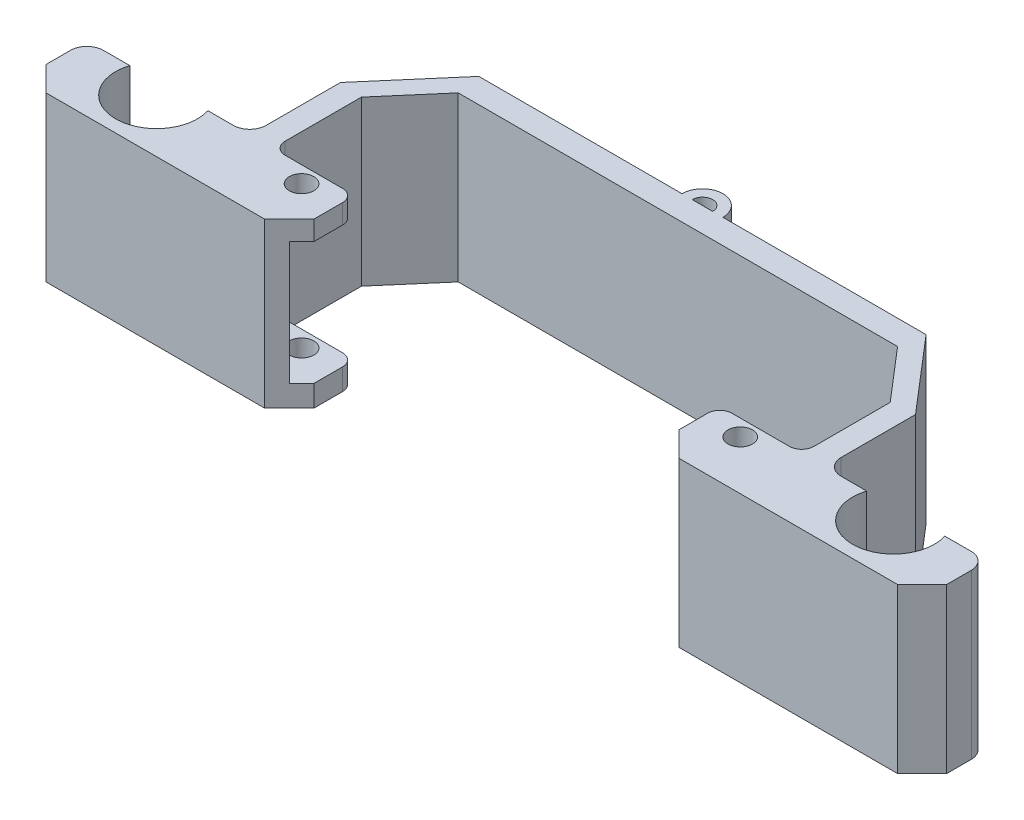
from build123d import *

# Parameters (mm, degrees)
EXTRUDE_1_DEPTH     = 20
SKETCH_2_W          = 10
SKETCH_2_H          = 8
SKETCH_2_R          = 1.5
EXTRUDE_2_DEPTH     = 20
SKETCH_3_W          = 10
SKETCH_3_H          = 15
CUT_EXTRUDE_1_DEPTH = 6.5
CHAMFER_1_SIZE      = 3
FILLET_1_R          = 2
FILLET_2_R          = 1.5
EXTRUDE_3_DEPTH     = 20


with BuildPart() as part:
    # 草图1 → 凸台-拉伸1 (new body)
    with BuildSketch(Plane(origin=(0, 0, 0), x_dir=(1, 0, 0), z_dir=(0, 1, 0))):
        with BuildLine():
            Line((-52.384848004, 0), (-49.769696007, 0))
            ThreePointArc((-49.769696007, 0), (-45, -6.5), (-40.230303993, 0))
            Line((-40.230303993, 0), (-35.115151996, 0))
            Line((-35.115151996, 0), (-35.115151996, 11.078445968))
            Line((-35.115151996, 11.078445968), (-27.310228331, 20.17100506))
            Line((-27.310228331, 20.17100506), (27.310228331, 20.17100506))
            Line((27.310228331, 20.17100506), (35.115151996, 11.078445968))
            Line((35.115151996, 11.078445968), (35.115151996, 0))
            Line((35.115151996, 0), (40.230303993, 0))
            ThreePointArc((40.230303993, 0), (45, -6.5), (49.769696007, 0))
            Line((49.769696007, 0), (52.384848004, 0))
            Line((52.384848004, 0), (55, 0))
            Line((55, 0), (55, -8))
            Line((55, -8), (32.287206254, -8))
            Line((32.287206254, -8), (32.287206254, 10.811768263))
            Line((32.287206254, 10.811768263), (26.82852765, 17.17100506))
            Line((26.82852765, 17.17100506), (-26.82852765, 17.17100506))
            Line((-26.82852765, 17.17100506), (-32.287206254, 10.811768263))
            Line((-32.287206254, 10.811768263), (-32.287206254, -8))
            Line((-32.287206254, -8), (-55, -8))
            Line((-55, -8), (-55, 0))
            Line((-55, 0), (-52.384848004, 0))
        make_face()
    extrude(amount=EXTRUDE_1_DEPTH)

    # 草图2 → 凸台-拉伸2 (add)
    with BuildSketch(Plane(origin=(0, 20, 0), x_dir=(1, 0, 0), z_dir=(0, 1, 0))):
        with Locations((-27.287206254, -4)):
            Rectangle(SKETCH_2_W, SKETCH_2_H)
        with Locations(Location((-26.787206254, -2, 0), (0, 0, 270))):
            Circle(SKETCH_2_R, mode=Mode.SUBTRACT)
    extrude(amount=-EXTRUDE_2_DEPTH)

    # 草图3 → 切除-拉伸1 (cut)
    with BuildSketch(Plane(origin=(0, 0, 0), x_dir=(-1, 0, 0), z_dir=(0, 0, -1))):
        with Locations((27.287206254, 10.122040723)):
            Rectangle(SKETCH_3_W, SKETCH_3_H)
    extrude(amount=-CUT_EXTRUDE_1_DEPTH, mode=Mode.SUBTRACT)

    # 镜向1: part across plane


with BuildPart() as part_1:
    add(part.part)
    add(part.part.mirror(Plane.ZY))

    # 倒角1
    # the kernel refuses this chamfer: 3 mm, written as the material it takes off along each edge
    with BuildSketch(Plane(origin=(22.287206254, 27.715048964, 8), x_dir=(-0.027495876610587933, 0, -0.9996219169112968), z_dir=(0, -1, 0)), Plane(origin=(-22.287206254, 27.715048964, 8), x_dir=(-0.9996219169112968, 0, 0.02749587661058619), z_dir=(0, -1, 0))) as chamfer_1_piece_1:
        Polygon((CHAMFER_1_SIZE * 0.999621916911, CHAMFER_1_SIZE * 0.0274958766106), (-CHAMFER_1_SIZE * 0.0274958766106, CHAMFER_1_SIZE * 0.999621916911), (0, 0), align=None)
    extrude(amount=35.430097928, mode=Mode.SUBTRACT)
    with BuildSketch(Plane(origin=(55, -7.715048964, 8), x_dir=(-0.9996219169112965, 0, 0.02749587661058705), z_dir=(0, 1, 0)), Plane(origin=(-55, -7.715048964, 8), x_dir=(-0.027495876610586775, 0, -0.9996219169112968), z_dir=(0, 1, 0))) as chamfer_1_piece_2:
        Polygon((CHAMFER_1_SIZE * 0.999621916911, -CHAMFER_1_SIZE * 0.0274958766106), (-CHAMFER_1_SIZE * 0.0274958766106, -CHAMFER_1_SIZE * 0.999621916911), (0, 0), align=None)
    extrude(amount=35.430097928, mode=Mode.SUBTRACT)

    # 圆角1
    fillet_1_edges = [part_1.edges().sort_by_distance(p)[0] for p in [
        (32.287206254, 10.122040723, 6.5),
        (55, 10, 0),
        (-55, 10, 0),
        (-35.115151996, 10, 0),
        (35.115151996, 10, 0),
        (-32.287206254, 10.122040723, 6.5),
    ]]
    fillet(fillet_1_edges, radius=FILLET_1_R)

    # 圆角2
    fillet_2_edges = [part_1.edges().sort_by_distance(p)[0] for p in [
        (22.287206254, 1.311020362, 0),
        (32.287206254, 1.311020362, 0),
        (32.287206254, 18.811020362, 0),
        (22.287206254, 18.811020362, 0),
        (-22.287206254, 1.311020362, 0),
        (-32.287206254, 1.311020362, 0),
        (-32.287206254, 18.811020362, 0),
        (-22.287206254, 18.811020362, 0),
    ]]
    fillet(fillet_2_edges, radius=FILLET_2_R)

    # 草图4 → 凸台-拉伸3 (add)
    with BuildSketch(Plane(origin=(0, 20, 0), x_dir=(1, 0, 0), z_dir=(0, 1, 0))):
        with BuildLine():
            Line((-2.5, 20.17100506), (-1.25, 20.17100506))
            ThreePointArc((-1.25, 20.17100506), (0, 21.42100506), (1.25, 20.17100506))
            Line((1.25, 20.17100506), (2.5, 20.17100506))
            ThreePointArc((2.5, 20.17100506), (0, 22.67100506), (-2.5, 20.17100506))
        make_face()
    extrude(amount=-EXTRUDE_3_DEPTH)


solid = part_1.part
